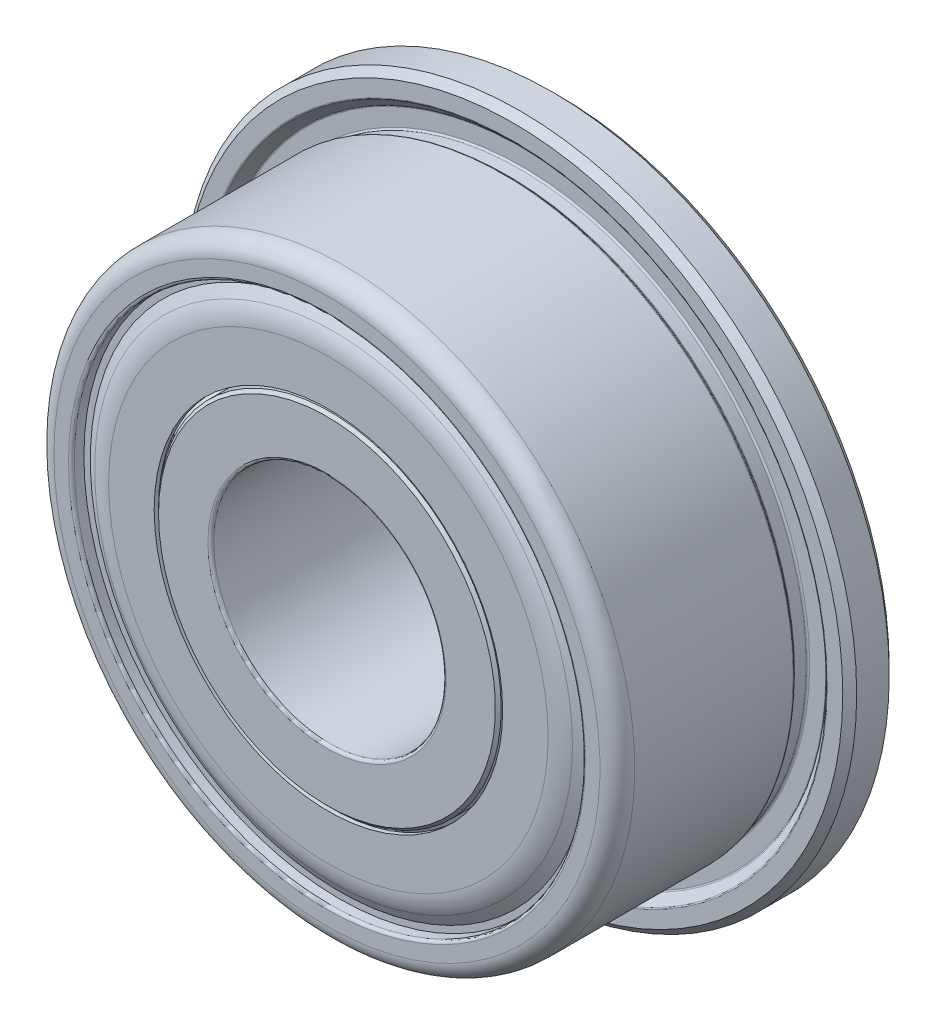
from build123d import *

# Parameters (mm, degrees)
CIRPATTERN1_COUNT  = 8
SKETCH9_R          = 3
CUT_EXTRUDE1_DEPTH = 9.111758441
SKETCH7_W          = 0.8
SKETCH7_H          = 1.4
FILLET2_R          = 0.3
FILLET3_R          = 0.05
FILLET5_R          = 0.03
CHAMFER1_SIZE      = 0.12
FILLET7_R          = 0.05


with BuildPart() as part:
    # Sketch3 → Revolve1 (revolve)
    with BuildSketch(Plane(origin=(0, 0, 0), x_dir=(0, 0, -1), z_dir=(1, 0, 0)), mode=Mode.PRIVATE) as revolve1_sk:
        with BuildLine():
            Line((-2, 5), (-2, 4.4))
            Line((-2, 4.4), (-0.779992845, 4.4))
            Line((-0.779992845, 4.4), (-0.779992845, 4.11))
            Line((-0.779992845, 4.11), (-0.579992845, 4.11))
            ThreePointArc((-0.579992845, 4.11), (0, 4.348692987), (0.579992845, 4.11))
            Line((0.579992845, 4.11), (0.779992845, 4.11))
            Line((0.779992845, 4.11), (0.779992845, 4.4))
            Line((0.779992845, 4.4), (2, 4.4))
            Line((2, 4.4), (2, 5))
            Line((2, 5), (-2, 5))
        make_face()
        with BuildLine():
            Line((2, 2), (-2, 2))
            Line((-2, 2), (-2, 2.95))
            Line((-2, 2.95), (-0.579992845, 2.95))
            ThreePointArc((-0.579992845, 2.95), (0, 2.700692987), (0.579992845, 2.95))
            Line((0.579992845, 2.95), (2, 2.95))
            Line((2, 2.95), (2, 2))
        make_face()
    revolve(revolve1_sk.sketch.rotate(Axis((0, 0, 2), (0, 0, -1)), 90), axis=Axis((0, 0, 2), (0, 0, -1)))

    # Sketch7 → Revolve5 (revolve)
    with BuildSketch(Plane(origin=(0, 0, 0), x_dir=(0, 0, -1), z_dir=(1, 0, 0)), mode=Mode.PRIVATE) as revolve5_sk:
        with Locations((1.6, 5.1)):
            Rectangle(SKETCH7_W, SKETCH7_H)
    revolve(revolve5_sk.sketch.rotate(Axis((0, 0, -2), (0, 0, 1)), 270), axis=Axis((0, 0, -2), (0, 0, 1)))

    # Fillet2
    fillet2_edges = [part.edges().sort_by_distance(p)[0] for p in [
        (-5, 0, 2),
    ]]
    fillet(fillet2_edges, radius=FILLET2_R)

    # Fillet3
    fillet3_edges = [part.edges().sort_by_distance(p)[0] for p in [
        (-4.4, 0, 0.779992845),
        (-4.4, 0, 2),
        (-4.4, 0, -2),
        (-4.4, 0, -0.779992845),
    ]]
    fillet(fillet3_edges, radius=FILLET3_R)

    # Fillet6
    # the kernel refuses this chamfer: 0.05 mm, written as the material it takes off along each edge
    with BuildSketch(Plane(origin=(0, 0, 2), x_dir=(1, 0, 0), z_dir=(0, 1, 0))) as fillet6_piece_1:
        with BuildLine():
            Line((2.898585786, -0.001414214), (2.951414214, 0.051414214))
            Line((2.951414214, 0.051414214), (2.952414214, 0.051414214))
            ThreePointArc((2.952414214, 0.051414214), (2.951, 0.025707107), (2.951, 0))
            Line((2.951, 0), (2.95, -0.001))
            ThreePointArc((2.95, -0.001), (2.924292893, -0.001), (2.898585786, -0.002414214))
            Line((2.898585786, -0.002414214), (2.898585786, -0.001414214))
        make_face()
    revolve(axis=Axis((0, 0, 2), (0, 0, -1)), mode=Mode.SUBTRACT)
    with BuildSketch(Plane(origin=(0, 0, 0.579992845), x_dir=(1, 0, 0), z_dir=(0, 1, 0))) as fillet6_piece_2:
        with BuildLine():
            Line((2.950766214, -0.022955554), (2.934556702, 0.016126995))
            Line((2.934556702, 0.016126995), (2.93526316, 0.016834749))
            ThreePointArc((2.93526316, 0.016834749), (2.942655386, 0.008450137), (2.950688096, 0.00072562))
            Line((2.950688096, 0.00072562), (2.951, 0))
            ThreePointArc((2.951, 0), (2.951, -0.011477777), (2.951766214, -0.022955554))
            Line((2.951766214, -0.022955554), (2.950766214, -0.022955554))
        make_face()
    revolve(axis=Axis((0, 0, 0.579992845), (0, 0, -1)), mode=Mode.SUBTRACT)
    with BuildSketch(Plane(origin=(0, 0, -0.579992845), x_dir=(1, 0, 0), z_dir=(0, 1, 0))) as fillet6_piece_3:
        with BuildLine():
            Line((2.950766214, 0.022955554), (2.934556702, -0.016126995))
            Line((2.934556702, -0.016126995), (2.93526316, -0.016834749))
            ThreePointArc((2.93526316, -0.016834749), (2.942655386, -0.008450137), (2.950688096, -0.00072562))
            Line((2.950688096, -0.00072562), (2.951, 0))
            ThreePointArc((2.951, 0), (2.951, 0.011477777), (2.951766214, 0.022955554))
            Line((2.951766214, 0.022955554), (2.950766214, 0.022955554))
        make_face()
    revolve(axis=Axis((0, 0, -0.579992845), (0, 0, -1)), mode=Mode.SUBTRACT)
    with BuildSketch(Plane(origin=(0, 0, -2), x_dir=(1, 0, 0), z_dir=(0, 1, 0))) as fillet6_piece_4:
        with BuildLine():
            Line((2.951414214, -0.051414214), (2.898585786, 0.001414214))
            Line((2.898585786, 0.001414214), (2.898585786, 0.002414214))
            ThreePointArc((2.898585786, 0.002414214), (2.924292893, 0.001), (2.95, 0.001))
            Line((2.95, 0.001), (2.951, 0))
            ThreePointArc((2.951, 0), (2.951, -0.025707107), (2.952414214, -0.051414214))
            Line((2.952414214, -0.051414214), (2.951414214, -0.051414214))
        make_face()
    revolve(axis=Axis((0, 0, -2), (0, 0, -1)), mode=Mode.SUBTRACT)

    # Sketch8 → Cut-Revolve1 (revolve, cut)
    with BuildSketch(Plane(origin=(0, 0, 0), x_dir=(0, 0, -1), z_dir=(1, 0, 0)), mode=Mode.PRIVATE) as cut_revolve1_sk:
        Polygon((1.2, 5.4), (1.36, 5.24), (1.36, 4.92), (1.12, 4.92), (1.04, 5), (1.2, 5), align=None)
    revolve(cut_revolve1_sk.sketch.rotate(Axis((0, 0, 2), (0, 0, -1)), 270), axis=Axis((0, 0, 2), (0, 0, -1)), mode=Mode.SUBTRACT)

    # Fillet5
    fillet5_edges = [part.edges().sort_by_distance(p)[0] for p in [
        (5.4, 0, -1.2),
        (0, 5, -1.04),
        (4.92, 0, -1.12),
        (4.92, 0, -1.36),
        (5.24, 0, -1.36),
    ]]
    fillet(fillet5_edges, radius=FILLET5_R)

    # Chamfer1
    chamfer1_edges = [part.edges().sort_by_distance(p)[0] for p in [
        (-5.8, 0, -2),
        (-5.8, 0, -1.2),
    ]]
    chamfer(chamfer1_edges, length=CHAMFER1_SIZE)

    # Fillet7
    fillet7_edges = [part.edges().sort_by_distance(p)[0] for p in [
        (-2, 0, -2),
        (-2, 0, 2),
    ]]
    fillet(fillet7_edges, radius=FILLET7_R)


with BuildPart() as body_2:
    # Sketch5 → Revolve3 (revolve)
    with BuildSketch(Plane(origin=(0, 0, 0), x_dir=(0, 0, -1), z_dir=(1, 0, 0))):
        with BuildLine():
            Line((-0.794, 3.524692987), (0.794, 3.524692987))
            ThreePointArc((0.794, 3.524692987), (0, 4.318692987), (-0.794, 3.524692987))
        make_face()
    revolve(axis=Axis((0, 3.524692987, 0.794), (0, 0, -1)))


with BuildPart() as cirpattern1_1:
    # CirPattern1: pattern copy
    add(body_2.part.rotate(Axis((0, 0, 0), (0, 0, 1)), 1 * 360 / CIRPATTERN1_COUNT))


with BuildPart() as cirpattern1_2:
    # CirPattern1: pattern copy
    add(body_2.part.rotate(Axis((0, 0, 0), (0, 0, 1)), 2 * 360 / CIRPATTERN1_COUNT))


with BuildPart() as cirpattern1_3:
    # CirPattern1: pattern copy
    add(body_2.part.rotate(Axis((0, 0, 0), (0, 0, 1)), 3 * 360 / CIRPATTERN1_COUNT))


with BuildPart() as cirpattern1_4:
    # CirPattern1: pattern copy
    add(body_2.part.rotate(Axis((0, 0, 0), (0, 0, 1)), 4 * 360 / CIRPATTERN1_COUNT))


with BuildPart() as cirpattern1_5:
    # CirPattern1: pattern copy
    add(body_2.part.rotate(Axis((0, 0, 0), (0, 0, 1)), 5 * 360 / CIRPATTERN1_COUNT))


with BuildPart() as cirpattern1_6:
    # CirPattern1: pattern copy
    add(body_2.part.rotate(Axis((0, 0, 0), (0, 0, 1)), 6 * 360 / CIRPATTERN1_COUNT))


with BuildPart() as cirpattern1_7:
    # CirPattern1: pattern copy
    add(body_2.part.rotate(Axis((0, 0, 0), (0, 0, 1)), 7 * 360 / CIRPATTERN1_COUNT))


with BuildPart() as body_10:
    # Sketch6 → Revolve4 (revolve)
    with BuildSketch(Plane(origin=(0, 0, 0), x_dir=(0, 0, -1), z_dir=(1, 0, 0)), mode=Mode.PRIVATE) as revolve4_sk:
        with BuildLine():
            Line((-1.975, 2.95), (-1.975, 3.783153533))
            ThreePointArc((-1.975, 3.783153533), (-1.952511045, 3.953974103), (-1.886576766, 4.113153533))
            Line((-1.886576766, 4.113153533), (-1.784474411, 4.29))
            Line((-1.784474411, 4.29), (-1.784474411, 4.4))
            Line((-1.784474411, 4.4), (-1.697871871, 4.4))
            Line((-1.697871871, 4.4), (-1.697871871, 4.29))
            Line((-1.697871871, 4.29), (-1.9, 3.939903811))
            Line((-1.9, 3.939903811), (-1.9, 2.95))
            Line((-1.9, 2.95), (-1.975, 2.95))
        make_face()
    revolve(revolve4_sk.sketch.rotate(Axis((0, 0, 2), (0, 0, -1)), 90), axis=Axis((0, 0, 2), (0, 0, -1)))


with BuildPart() as body_11:
    # Mirror1: mirrored copy
    add(body_10.part.mirror(Plane.XY))


with BuildPart() as cut_extrude1_tool:
    # Sketch9 → Cut-Extrude1 (new, through all)
    with BuildSketch(Plane.XY.offset(1.975)):
        Circle(SKETCH9_R)
    extrude(amount=-CUT_EXTRUDE1_DEPTH)


with BuildPart() as body_10_1:
    add(body_10.part)

    # Cut-Extrude1: cut by cut_extrude1_tool
    add(cut_extrude1_tool.part, mode=Mode.SUBTRACT)


with BuildPart() as body_11_1:
    add(body_11.part)

    # Cut-Extrude1: cut by cut_extrude1_tool
    add(cut_extrude1_tool.part, mode=Mode.SUBTRACT)


solid = Compound([part.part, body_2.part, cirpattern1_1.part, cirpattern1_2.part, cirpattern1_3.part, cirpattern1_4.part, cirpattern1_5.part, cirpattern1_6.part, cirpattern1_7.part, body_10_1.part, body_11_1.part])
